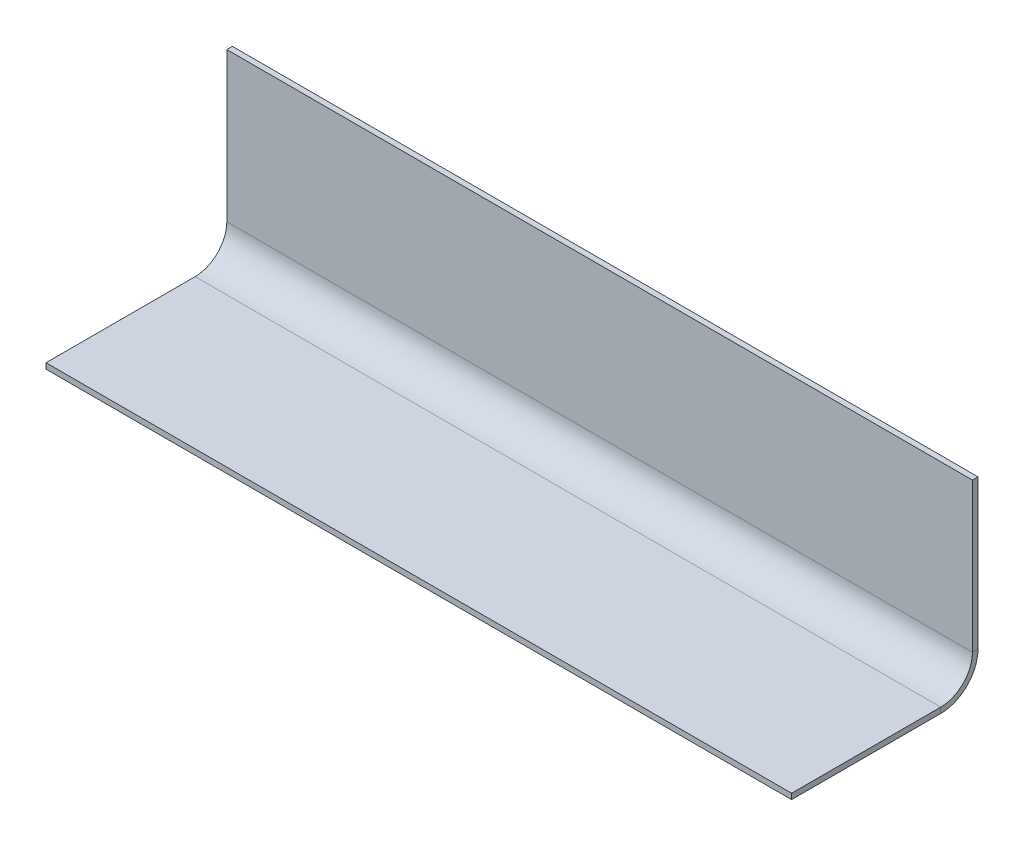
from build123d import *

# Parameters (mm, degrees)
SKETCH_2_W                       = 400
SKETCH_2_H                       = 100
SM_BASE_FLANGE_1_DEPTH           = 3
SM_EDGE_FLANGE_1_STRIP_W         = 46
SM_EDGE_FLANGE_1_STRIP_H         = 3
SM_EDGE_FLANGE_1_STRIP_CUT_DEPTH = 400
SM_EDGE_FLANGE_1_DEPTH           = 400


# Sheet-metal steps are written as plain solids
with BuildPart() as part:
    # Sketch 2 → 基体-法兰1 (new body)
    with BuildSketch(Plane.XY):
        Rectangle(SKETCH_2_W, SKETCH_2_H)
    extrude(amount=-SM_BASE_FLANGE_1_DEPTH)

    # 边线-法兰1 strip (across the edge) → 边线-法兰1 strip cut (cut)
    with BuildSketch(Plane(origin=(-200, -50, 0), x_dir=(0, 1, 0), z_dir=(1, 0, 0))):
        with Locations((-3, -1.5)):
            Rectangle(SM_EDGE_FLANGE_1_STRIP_W, SM_EDGE_FLANGE_1_STRIP_H)
    extrude(amount=SM_EDGE_FLANGE_1_STRIP_CUT_DEPTH, mode=Mode.SUBTRACT)

    # 边线-法兰1 section (across the edge) → 边线-法兰1 (add)
    with BuildSketch(Plane(origin=(-200, -50, 0), x_dir=(0, 1, 0), z_dir=(1, 0, 0))):
        with BuildLine():
            Line((0, 17), (0, 97))
            Line((0, 97), (3, 97))
            Line((3, 97), (3, 17))
            ThreePointArc((3, 17), (7.97918472, 4.97918472), (20, 0))
            Line((20, 0), (20, -3))
            ThreePointArc((20, -3), (5.857864376, 2.857864376), (0, 17))
        make_face()
    extrude(amount=SM_EDGE_FLANGE_1_DEPTH)


solid = part.part
